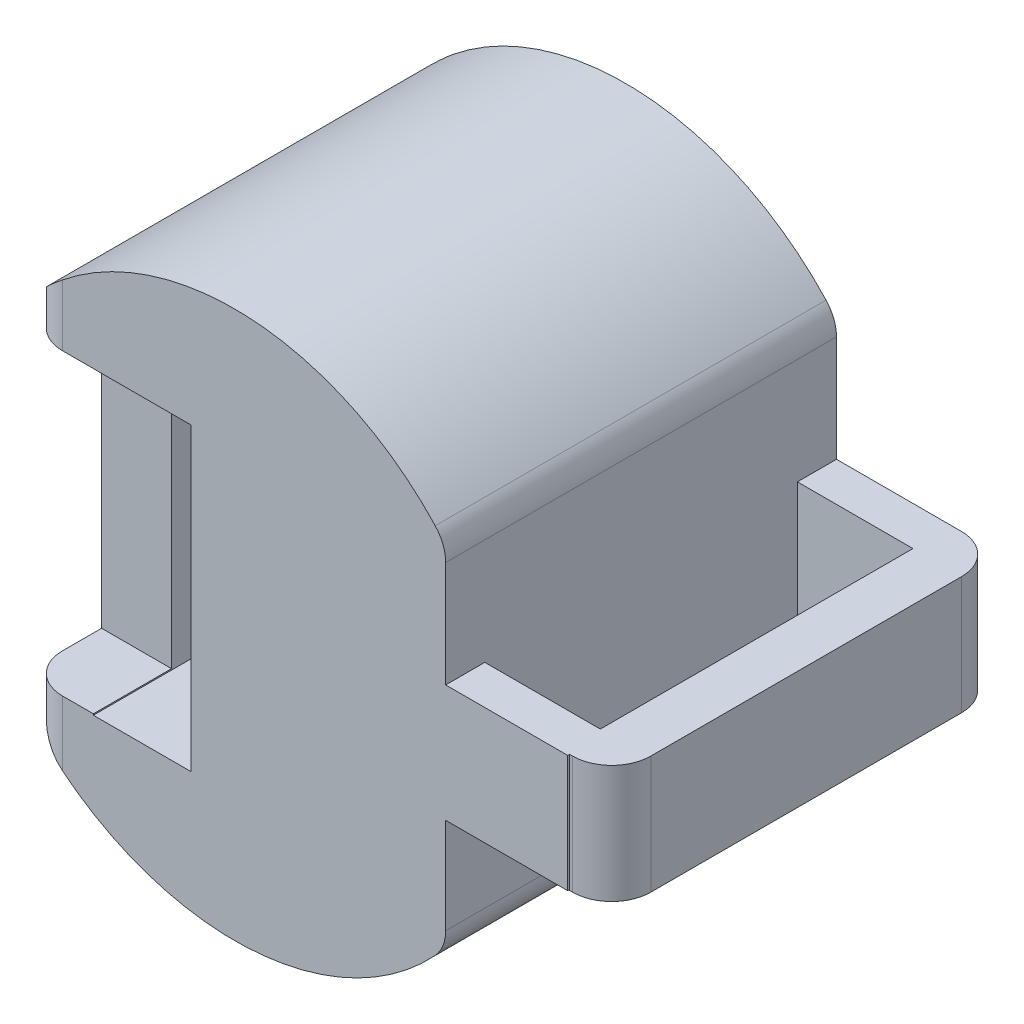
from build123d import *

# Parameters (mm, degrees)
SKETCH_1_R            = 7
EXTRUDE_1_DEPTH       = 10
SKETCH_9_W            = 7.120641766
SKETCH_9_H            = 4.534999238
EXTRUDE_6_DEPTH       = 1
SKETCH_11_W           = 1.257653538
SKETCH_11_H           = 9
EXTRUDE_7_DEPTH       = 4.5
EXTRUDE_8_DEPTH       = 6
FILLET_8_R            = 1
FILLET_9_R            = 1
CUT_EXTRUDE_1_DEPTH   = 10
SKETCH_14_W           = 1
SKETCH_14_H           = 3
EXTRUDE_9_DEPTH       = 3.122043073
SKETCH_15_W           = 1
SKETCH_15_H           = 3
EXTRUDE_10_DEPTH      = 4
EXTRUDE_11_DEPTH      = 0.2
EXTRUDE_11_DEPTH_BACK = 1.043632387
SKETCH_16_W           = 9.952294967
SKETCH_16_H           = 3.01746433
FILLET_11_R           = 1
FILLET_12_R           = 1
FILLET_13_R           = 1
FILLET_14_R           = 1
CUT_EXTRUDE_2_DEPTH   = 10
SKETCH_18_W           = 2.5
SKETCH_18_H           = 7.68123899
CUT_EXTRUDE_3_DEPTH   = 10
SKETCH_19_W           = 1.790352256
SKETCH_19_H           = 7.68123899
CUT_EXTRUDE_4_DEPTH   = 2
SKETCH_20_W           = 1.790352256
SKETCH_20_H           = 7.649055087
CUT_EXTRUDE_5_DEPTH   = 2
FILLET_15_R           = 1
FILLET_16_R           = 1
FILLET_17_R           = 1
FILLET_18_R           = 1


with BuildPart() as part:
    # 草圖1 → 填料-伸長1 (new body)
    with BuildSketch(Plane(origin=(0.382706605, 0, 0), x_dir=(1, 0, 0), z_dir=(0, 0, 1))):
        with Locations((-75.594417438, 2.55)):
            Circle(SKETCH_1_R)
    extrude(amount=EXTRUDE_1_DEPTH)

    # 草圖9 → 填料-伸長6 (add)
    with BuildSketch(Plane(origin=(6.127831546, 0, 9), x_dir=(1, 0, 0), z_dir=(0, 0, 1))):
        with Locations((-75.644850643, 2.267499619)):
            Rectangle(SKETCH_9_W, SKETCH_9_H)
    extrude(amount=EXTRUDE_6_DEPTH)



with BuildPart() as body_2:
    # 草圖11 → 填料-伸長7 (new body)
    with BuildSketch(Plane(origin=(9.574526933, 4.534999238, 0.48426017), x_dir=(1, 0, 0), z_dir=(0, 1, 0))):
        with Locations((-76.184774061, -4.5)):
            Rectangle(SKETCH_11_W, SKETCH_11_H)
    extrude(amount=-EXTRUDE_7_DEPTH)


with BuildPart() as part_1:
    add(part.part)

    add(body_2.part)  # 填料-伸長8 merges body 2
    # 草圖12 → 填料-伸長8 (add)
    with BuildSketch(Plane.ZY.offset(67.239073897)):
        Polygon((0.48426017, 4.534999238), (0.48426017, 0), (1.483647509, 0.034999238), (1.483647509, 4.534999238), align=None)
    extrude(amount=EXTRUDE_8_DEPTH)

    # 圓角8
    fillet_8_edges = [part_1.edges().sort_by_distance(p)[0] for p in [
        (-65.981420359, 2.284999238, 0.48426017),
    ]]
    fillet(fillet_8_edges, radius=FILLET_8_R)

    # 圓角9
    fillet_9_edges = [part_1.edges().sort_by_distance(p)[0] for p in [
        (-65.956698214, 2.267499619, 10),
    ]]
    fillet(fillet_9_edges, radius=FILLET_9_R - 0.0001)  # a hair under: the kernel refuses the full size

    # 草圖13 → 除料-伸長1 (cut)
    with BuildSketch(Plane(origin=(0, 0, 0), x_dir=(-1, 0, 0), z_dir=(0, 0, -1))):
        with BuildLine():
            Line((69.812827514, 7.005564937), (69.812827514, -1.905564937))
            ThreePointArc((69.812827514, -1.905564937), (67.081734981, 2.55), (69.812827514, 7.005564937))
        make_face()
    extrude(amount=-CUT_EXTRUDE_1_DEPTH, mode=Mode.SUBTRACT)


with BuildPart() as cut_extrude_1_kept_piece:
    # of the separate pieces the step leaves, the one the design keeps (cut_extrude_1_pieces_kept)
    add(part_1.part.solids().sort_by_distance((-69.812827514, 7.005564937, 10))[0])

    # 草圖14 → 填料-伸長9 (add)
    with BuildSketch(Plane(origin=(-69.812827514, 0, 0), x_dir=(0, 0, -1), z_dir=(1, 0, 0))):
        with Locations((-9.5, 2.417510407)):
            Rectangle(SKETCH_14_W, SKETCH_14_H)
    extrude(amount=EXTRUDE_9_DEPTH)

    # 草圖15 → 填料-伸長10 (add)
    with BuildSketch(Plane(origin=(-69.812827514, 0, 0), x_dir=(0, 0, -1), z_dir=(1, 0, 0))):
        with Locations((-0.5, 2.417510407)):
            Rectangle(SKETCH_15_W, SKETCH_15_H)
    extrude(amount=EXTRUDE_10_DEPTH)

    # 草圖16 → 填料-伸長11 (add, two sides: drawn at the far end of the back side and taken through both)
    with BuildSketch(Plane(origin=(-65.812827514, 0, 0), x_dir=(0, 0, -1), z_dir=(1, 0, 0)).offset(-EXTRUDE_11_DEPTH_BACK)):
        with Locations((-4.976147484, 2.408778242)):
            Rectangle(SKETCH_16_W, SKETCH_16_H)
    extrude(amount=EXTRUDE_11_DEPTH + EXTRUDE_11_DEPTH_BACK)

    # 圓角11
    fillet_11_edges = [cut_extrude_1_kept_piece.edges().sort_by_distance(p)[0] for p in [
        (-65.612827514, 2.408778242, 0),
    ]]
    fillet(fillet_11_edges, radius=FILLET_11_R)

    # 圓角12
    fillet_12_edges = [cut_extrude_1_kept_piece.edges().sort_by_distance(p)[0] for p in [
        (-65.612827514, 2.408778242, 9.952294967),
    ]]
    fillet(fillet_12_edges, radius=FILLET_12_R)

    # 圓角13
    fillet_13_edges = [cut_extrude_1_kept_piece.edges().sort_by_distance(p)[0] for p in [
        (-69.812827514, 7.005564937, 5),
    ]]
    fillet(fillet_13_edges, radius=FILLET_13_R)

    # 圓角14
    fillet_14_edges = [cut_extrude_1_kept_piece.edges().sort_by_distance(p)[0] for p in [
        (-69.812827514, -1.905564937, 5),
    ]]
    fillet(fillet_14_edges, radius=FILLET_14_R)

    # 草圖17 → 除料-伸長2 (cut)
    with BuildSketch(Plane(origin=(0, 0, 0), x_dir=(-1, 0, 0), z_dir=(0, 0, -1))):
        with BuildLine():
            Line((80.617907093, 6.99668888), (80.617907093, -1.89668888))
            ThreePointArc((80.617907093, -1.89668888), (82.589637241, 2.55), (80.617907093, 6.99668888))
        make_face()
    extrude(amount=-CUT_EXTRUDE_2_DEPTH, mode=Mode.SUBTRACT)

    # 草圖18 → 除料-伸長3 (cut)
    with BuildSketch(Plane(origin=(0, 0, 0), x_dir=(-1, 0, 0), z_dir=(0, 0, -1))):
        with Locations((77.577554837, 2.579171883)):
            Rectangle(SKETCH_18_W, SKETCH_18_H)
    extrude(amount=-CUT_EXTRUDE_3_DEPTH, mode=Mode.SUBTRACT)

    # 草圖19 → 除料-伸長4 (cut)
    with BuildSketch(Plane(origin=(0, 0, 0), x_dir=(-1, 0, 0), z_dir=(0, 0, -1))):
        with Locations((79.722730965, 2.579171883)):
            Rectangle(SKETCH_19_W, SKETCH_19_H)
    extrude(amount=-CUT_EXTRUDE_4_DEPTH, mode=Mode.SUBTRACT)

    # 草圖20 → 除料-伸長5 (cut)
    with BuildSketch(Plane.XY.offset(10)):
        with Locations((-79.722730965, 2.595263834)):
            Rectangle(SKETCH_20_W, SKETCH_20_H)
    extrude(amount=-CUT_EXTRUDE_5_DEPTH, mode=Mode.SUBTRACT)

    # 圓角15
    fillet_15_edges = [cut_extrude_1_kept_piece.edges().sort_by_distance(p)[0] for p in [
        (-80.617907093, 6.708240129, 0),
    ]]
    fillet(fillet_15_edges, radius=FILLET_15_R)

    # 圓角16
    fillet_16_edges = [cut_extrude_1_kept_piece.edges().sort_by_distance(p)[0] for p in [
        (-80.617907093, 6.708240129, 10),
    ]]
    fillet(fillet_16_edges, radius=FILLET_16_R)

    # 圓角17
    fillet_17_edges = [cut_extrude_1_kept_piece.edges().sort_by_distance(p)[0] for p in [
        (-80.617907093, -1.579068246, 0),
    ]]
    fillet(fillet_17_edges, radius=FILLET_17_R)

    # 圓角18
    fillet_18_edges = [cut_extrude_1_kept_piece.edges().sort_by_distance(p)[0] for p in [
        (-80.617907093, -1.562976295, 10),
    ]]
    fillet(fillet_18_edges, radius=FILLET_18_R)


solid = cut_extrude_1_kept_piece.part
